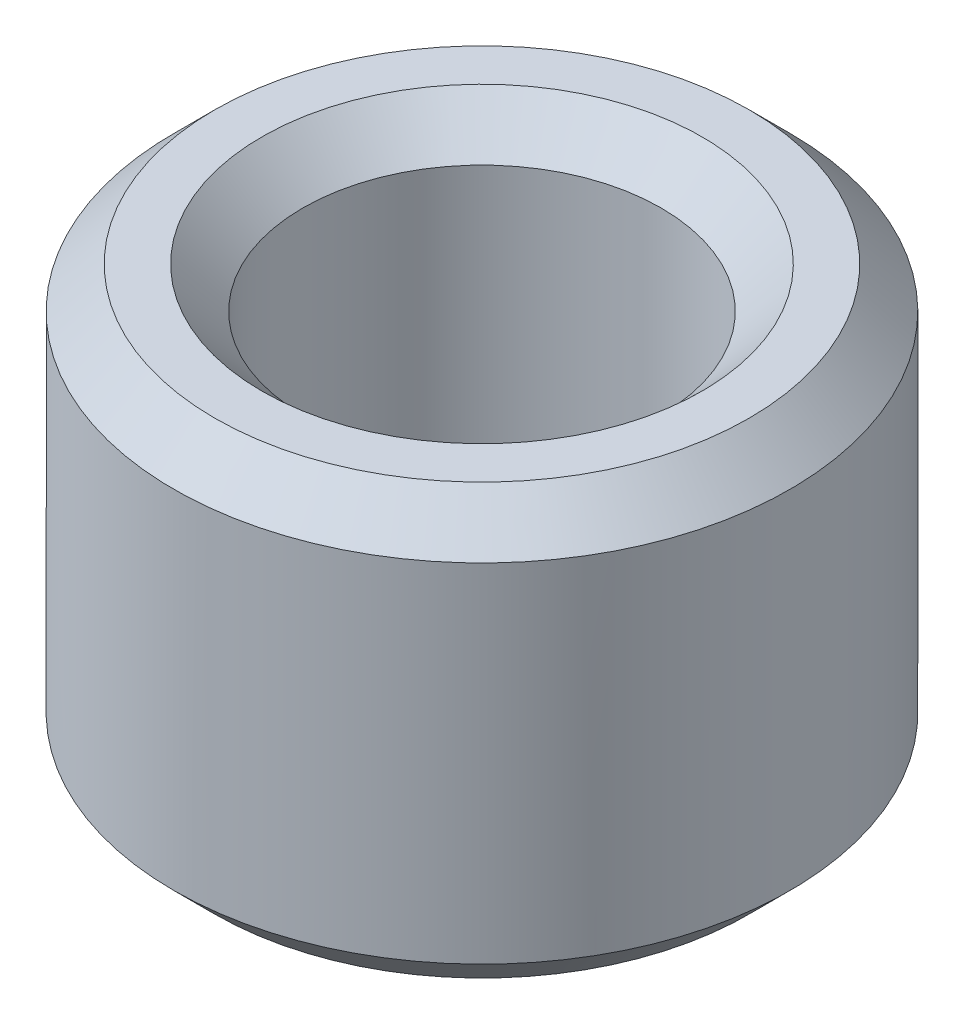
from build123d import *

# Parameters (mm, degrees)
SKETCH1_R           = 20
BOSS_EXTRUDE1_DEPTH = 27.874655979
SKETCH2_R           = 11.626037587
CUT_EXTRUDE1_DEPTH  = 40.711414555
CHAMFER1_SIZE       = 2.662260705


with BuildPart() as part:
    # Sketch1 → Boss-Extrude1 (new body)
    with BuildSketch(Plane(origin=(0, 0, 0), x_dir=(1, 0, 0), z_dir=(0, 1, 0))):
        Circle(SKETCH1_R)
    extrude(amount=BOSS_EXTRUDE1_DEPTH)

    # Sketch2 → Cut-Extrude1 (cut, through all)
    with BuildSketch(Plane(origin=(0, 0, 0), x_dir=(1, 0, 0), z_dir=(0, 1, 0))):
        Circle(SKETCH2_R)
    extrude(amount=CUT_EXTRUDE1_DEPTH, mode=Mode.SUBTRACT)

    # Chamfer1
    chamfer1_edges = [part.edges().sort_by_distance(p)[0] for p in [
        (-11.626037587, 27.874655979, 0),
        (-11.626037587, 0, 0),
        (-20, 0, 0),
        (-20, 27.874655979, 0),
    ]]
    chamfer(chamfer1_edges, length=CHAMFER1_SIZE)


solid = part.part
